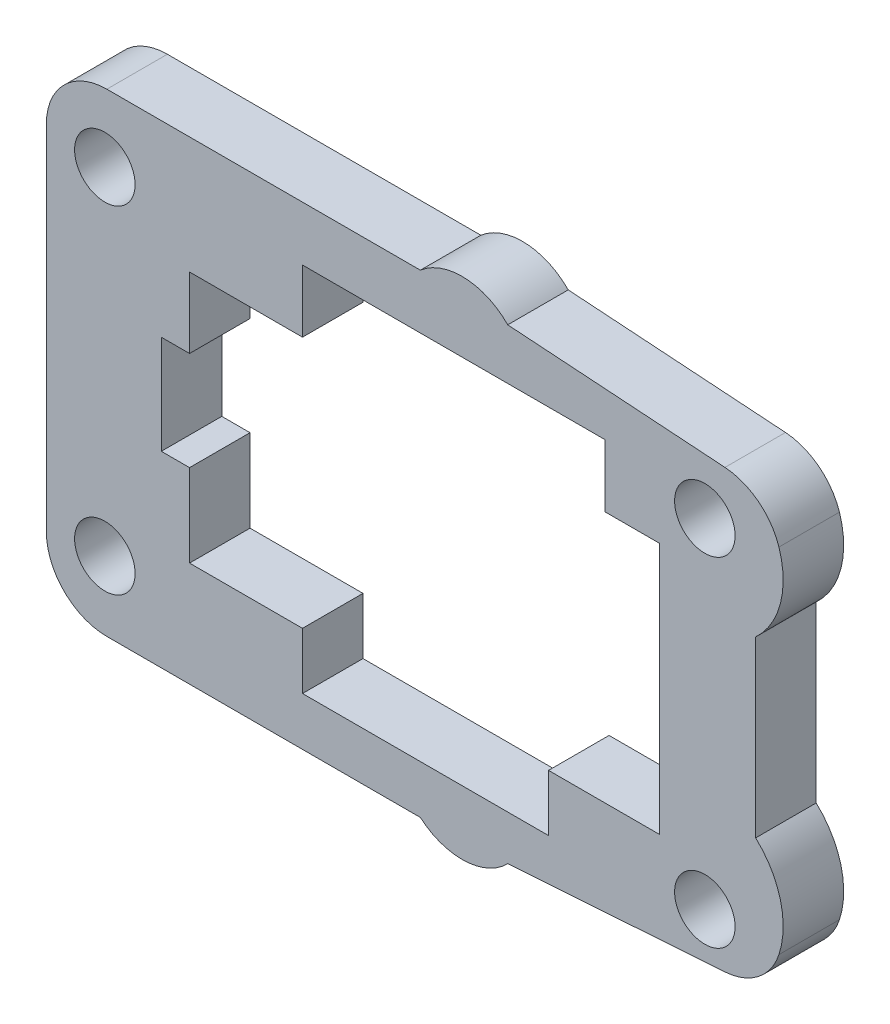
from build123d import *

# Parameters (mm, degrees)
ESQUISSE1_R               = 1.5
T_LE_DE_BASE_PLI_E1_DEPTH = 3


# Sheet-metal steps are written as plain solids
with BuildPart() as part:
    # Esquisse1 → Tôle de base pliée1 (new body)
    with BuildSketch(Plane.XY):
        with BuildLine():
            Line((1210.954881098, 2192.062900441), (1210.954881098, 2174.562900441))
            ThreePointArc((1210.954881098, 2174.562900441), (1211.833560754, 2172.441580098), (1213.954881098, 2171.562900441))
            Line((1213.954881098, 2171.562900441), (1229.498862267, 2171.562900441))
            ThreePointArc((1229.498862267, 2171.562900441), (1231.700410864, 2170.796575468), (1233.830537909, 2171.743480404))
            Line((1233.830537909, 2171.743480404), (1244.602630734, 2172.48006345))
            ThreePointArc((1244.602630734, 2172.48006345), (1246.258569693, 2173.112570346), (1247.278053022, 2174.56269191))
            ThreePointArc((1247.278053022, 2174.56269191), (1247.351627268, 2176.949418696), (1246.12416641, 2178.997641771))
            Line((1246.12416641, 2178.997641771), (1246.12416641, 2187.628159112))
            ThreePointArc((1246.12416641, 2187.628159112), (1247.351627268, 2189.676382187), (1247.278053022, 2192.063108973))
            ThreePointArc((1247.278053022, 2192.063108973), (1246.258569693, 2193.513230537), (1244.602630734, 2194.145737433))
            Line((1244.602630734, 2194.145737433), (1233.830537909, 2194.882320479))
            ThreePointArc((1233.830537909, 2194.882320479), (1231.700410864, 2195.829225415), (1229.498862267, 2195.062900441))
            Line((1229.498862267, 2195.062900441), (1213.954881098, 2195.062900441))
            ThreePointArc((1213.954881098, 2195.062900441), (1211.833560754, 2194.184220785), (1210.954881098, 2192.062900441))
        make_face()
        with Locations((1243.604881098, 2191.458119207)):
            Circle(ESQUISSE1_R, mode=Mode.SUBTRACT)
        with Locations((1213.854881098, 2191.662900441)):
            Circle(ESQUISSE1_R, mode=Mode.SUBTRACT)
        with Locations((1213.854881098, 2174.962900441)):
            Circle(ESQUISSE1_R, mode=Mode.SUBTRACT)
        with Locations((1243.604881098, 2174.670527055)):
            Circle(ESQUISSE1_R, mode=Mode.SUBTRACT)
        Polygon((1241.354881098, 2189.262900441), (1241.354881098, 2176.762900441), (1235.854881098, 2176.762900441), (1235.854881098, 2173.962900441), (1223.654881098, 2173.962900441), (1223.654881098, 2176.762900441), (1218.054881098, 2176.762900441), (1218.054881098, 2180.862900441), (1216.654881098, 2180.862900441), (1216.654881098, 2185.762900441), (1218.054881098, 2185.762900441), (1218.054881098, 2189.262900441), (1223.654881098, 2189.262900441), (1223.654881098, 2192.362900441), (1238.654881098, 2192.362900441), (1238.654881098, 2189.262900441), align=None, mode=Mode.SUBTRACT)
    extrude(amount=-T_LE_DE_BASE_PLI_E1_DEPTH)


solid = part.part
